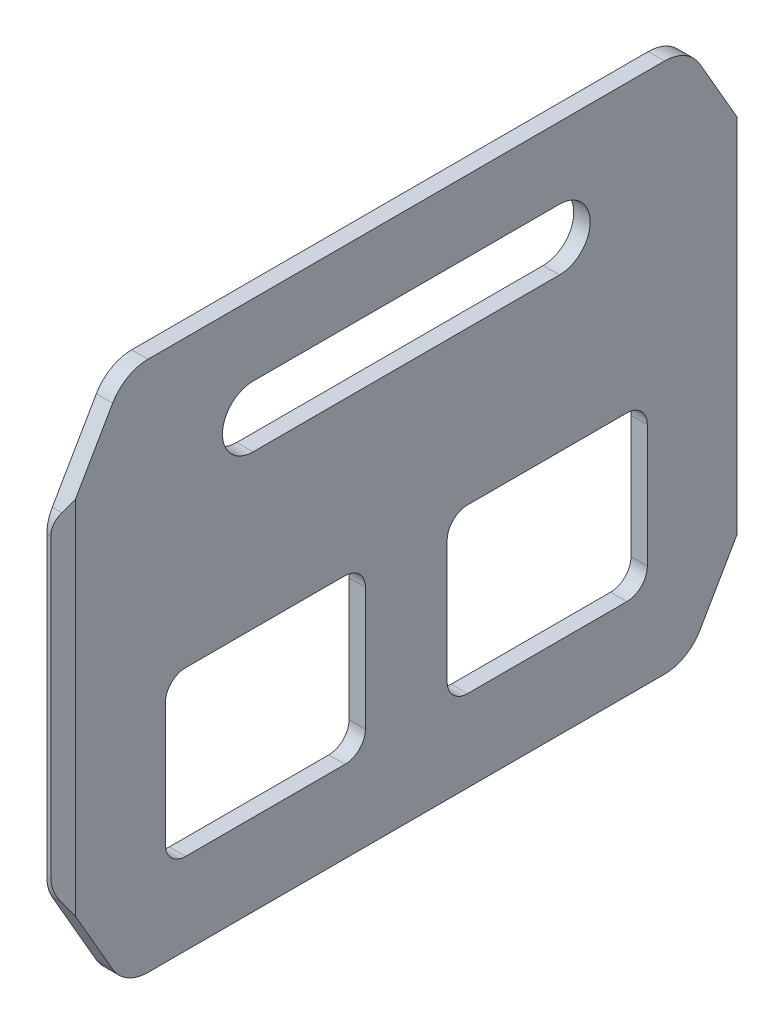
from build123d import *
from OCP.BRepFilletAPI import BRepFilletAPI_MakeChamfer

# Parameters (mm, degrees)
BOSS_EXTRUDE1_DEPTH = 10.16
SKETCH2_W           = 76.2
SKETCH2_H           = 10.16
CUT_EXTRUDE1_DEPTH  = 4.572
CHAMFER1_SIZE       = 38.1
CHAMFER1_SIZE2      = 65.991135768
FILLET1_R           = 25.4


with BuildPart() as part:
    # Sketch1 → Boss-Extrude1 (new body)
    with BuildSketch(Plane(origin=(0, 0, 0), x_dir=(0, 0, -1), z_dir=(1, 0, 0))):
        Polygon((-213.36, 0), (-213.36, 254), (-213.36, 279.4), (213.36, 279.4), (213.36, 254), (213.36, 0), (213.36, -50.8), (-213.36, -50.8), align=None)
        with BuildLine():
            Line((-95.25, 234.95), (95.25, 234.95))
            ThreePointArc((95.25, 234.95), (114.3, 215.9), (95.25, 196.85))
            Line((95.25, 196.85), (-95.25, 196.85))
            ThreePointArc((-95.25, 196.85), (-114.3, 215.9), (-95.25, 234.95))
        make_face(mode=Mode.SUBTRACT)
        with BuildLine():
            Line((38.1, 101.6), (137.16, 101.6))
            ThreePointArc((137.16, 101.6), (146.140256121, 97.880256121), (149.86, 88.9))
            Line((149.86, 88.9), (149.86, 12.7))
            ThreePointArc((149.86, 12.7), (146.140256121, 3.719743879), (137.16, 0))
            Line((137.16, 0), (38.1, 0))
            ThreePointArc((38.1, 0), (29.119743879, 3.719743879), (25.4, 12.7))
            Line((25.4, 12.7), (25.4, 88.9))
            ThreePointArc((25.4, 88.9), (29.119743879, 97.880256121), (38.1, 101.6))
        make_face(mode=Mode.SUBTRACT)
        with BuildLine():
            Line((-38.1, 0), (-137.16, 0))
            ThreePointArc((-137.16, 0), (-146.140256121, 3.719743879), (-149.86, 12.7))
            Line((-149.86, 12.7), (-149.86, 88.9))
            ThreePointArc((-149.86, 88.9), (-146.140256121, 97.880256121), (-137.16, 101.6))
            Line((-137.16, 101.6), (-38.1, 101.6))
            ThreePointArc((-38.1, 101.6), (-29.119743879, 97.880256121), (-25.4, 88.9))
            Line((-25.4, 88.9), (-25.4, 12.7))
            ThreePointArc((-25.4, 12.7), (-29.119743879, 3.719743879), (-38.1, 0))
        make_face(mode=Mode.SUBTRACT)
    extrude(amount=BOSS_EXTRUDE1_DEPTH)

    # Sketch2 → Cut-Extrude1 (cut)
    with BuildSketch(Plane(origin=(0, 0, 0), x_dir=(0, 0, -1), z_dir=(1, 0, 0))):
        with Locations((-158.75, 127)):
            Rectangle(SKETCH2_W, SKETCH2_H)
        with Locations((0, 127)):
            Rectangle(SKETCH2_W, SKETCH2_H)
        with Locations((158.75, 127)):
            Rectangle(SKETCH2_W, SKETCH2_H)
    extrude(amount=CUT_EXTRUDE1_DEPTH, mode=Mode.SUBTRACT)

    # Chamfer1: one chamfer whose edges measure the first distance from different faces: ONE call of the kernel's chamfer builder (chamfer() names one face for all edges)
    chamfer1_edges_1 = [part.edges().sort_by_distance(p)[0] for p in [
        (5.08, 279.4, 213.36),
        (5.08, 279.4, -213.36),
    ]]
    chamfer1_side_1 = [part.faces().sort_by_distance(p)[0] for p in [
        (5.08, 279.4, 0),
    ]]
    chamfer1_edges_2 = [part.edges().sort_by_distance(p)[0] for p in [
        (5.08, -50.8, -213.36),
        (5.08, -50.8, 213.36),
    ]]
    chamfer1_side_2 = [part.faces().sort_by_distance(p)[0] for p in [
        (5.08, -50.8, 0),
    ]]
    chamfer1 = BRepFilletAPI_MakeChamfer(part.part.solid().wrapped)
    for e in chamfer1_edges_1:
        chamfer1.Add(CHAMFER1_SIZE, CHAMFER1_SIZE2, e.wrapped, chamfer1_side_1[0].wrapped)  # the first distance lies on this face
    for e in chamfer1_edges_2:
        chamfer1.Add(CHAMFER1_SIZE, CHAMFER1_SIZE2, e.wrapped, chamfer1_side_2[0].wrapped)  # the first distance lies on this face
    add(Compound.cast(chamfer1.Shape()), mode=Mode.REPLACE)

    # Fillet1
    fillet1_edges = [part.edges().sort_by_distance(p)[0] for p in [
        (5.08, 15.191135768, 213.36),
        (5.08, 213.408864232, 213.36),
        (5.08, 279.4, -175.26),
        (5.08, 279.4, 175.26),
        (5.08, 15.191135768, -213.36),
        (5.08, 213.408864232, -213.36),
        (5.08, -50.8, -175.26),
        (5.08, -50.8, 175.26),
    ]]
    fillet(fillet1_edges, radius=FILLET1_R)

    # Chamfer2
    # the kernel refuses this chamfer: 7.62 mm, written as the material it takes off along each edge
    with BuildSketch(Plane(origin=(10.16, 253.633893228, -213.36), x_dir=(0.02749587661058636, 0, 0.9996219169112968), z_dir=(0, -1, 0))) as chamfer2_piece_1:
        with BuildLine():
            Line((7.838489747, 0), (-0.43088932, 7.826637587))
            Line((-0.43088932, 7.826637587), (-0.5832317, 7.822447215))
            ThreePointArc((-0.5832317, 7.822447215), (-0.26006471, 3.912091462), (-0.15234238, -0.004190372))
            Line((-0.15234238, -0.004190372), (0.004190372, -0.15234238))
            ThreePointArc((0.004190372, -0.15234238), (3.920472205, -0.04462005), (7.842680119, -0.15234238))
            Line((7.842680119, -0.15234238), (7.838489747, 0))
        make_face()
    extrude(amount=278.667786456, mode=Mode.SUBTRACT)
    with BuildSketch(Plane(origin=(10.16, -25.033893228, 213.36), x_dir=(-0.9996219169112968, 0, 0.027495876610586382), z_dir=(0, 1, 0))) as chamfer2_piece_2:
        with BuildLine():
            Line((7.838489747, 0), (-0.43088932, -7.826637587))
            Line((-0.43088932, -7.826637587), (-0.5832317, -7.822447215))
            ThreePointArc((-0.5832317, -7.822447215), (-0.26006471, -3.912091462), (-0.15234238, 0.004190372))
            Line((-0.15234238, 0.004190372), (0.004190372, 0.15234238))
            ThreePointArc((0.004190372, 0.15234238), (3.920472205, 0.04462005), (7.842680119, 0.15234238))
            Line((7.842680119, 0.15234238), (7.838489747, 0))
        make_face()
    extrude(amount=278.667786456, mode=Mode.SUBTRACT)


solid = part.part
